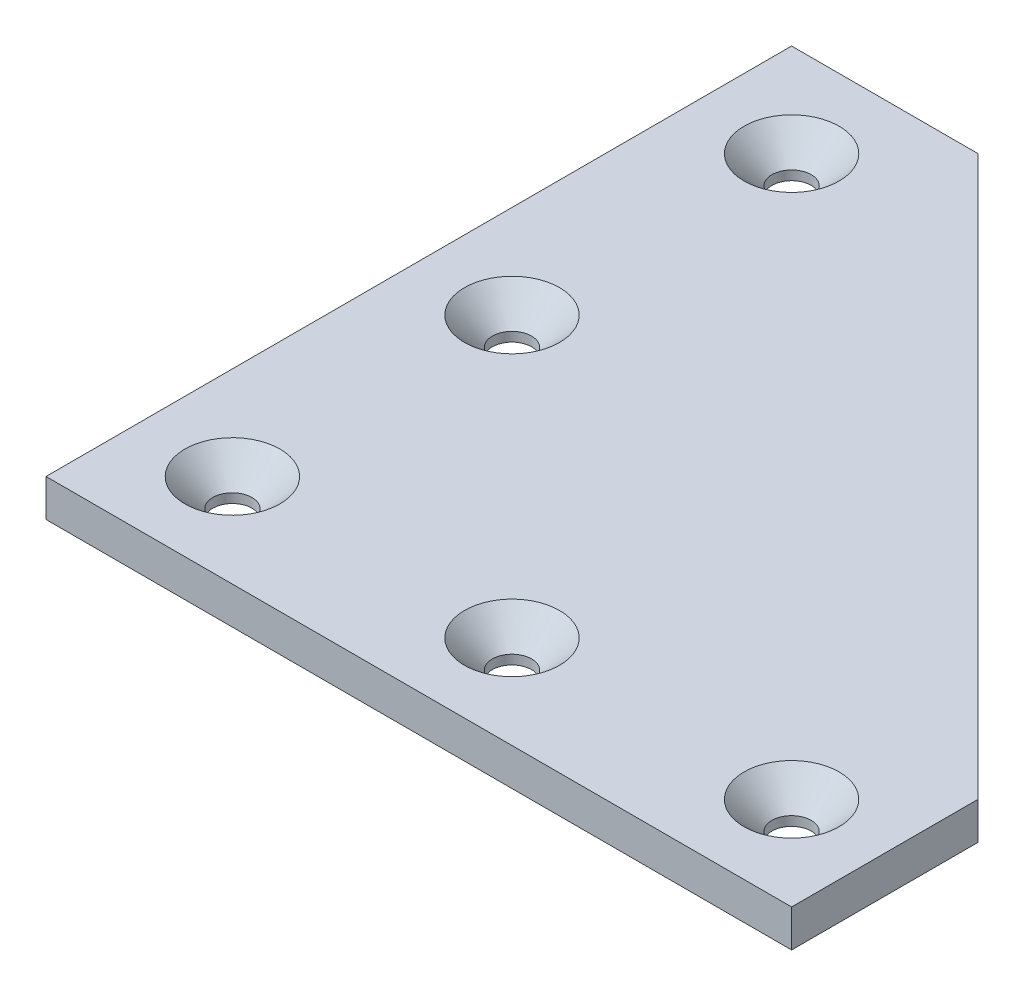
from build123d import *

# Parameters (mm, degrees)
BOSS_EXTRUDE1_DEPTH = 4
SKETCH3_R           = 2.1
CUT_EXTRUDE1_DEPTH  = 4
CHAMFER1_SIZE       = 3


with BuildPart() as part:
    # Sketch1 → Boss-Extrude1 (new body)
    with BuildSketch(Plane(origin=(0, 0, 0), x_dir=(1, 0, 0), z_dir=(0, 1, 0))):
        Polygon((0, 0), (0, 80), (20, 80), (80, 20), (80, 0), align=None)
    extrude(amount=BOSS_EXTRUDE1_DEPTH)

    # Sketch3 → Cut-Extrude1 (cut)
    with BuildSketch(Plane(origin=(0, 4, 0), x_dir=(1, 0, 0), z_dir=(0, 1, 0))):
        with Locations((10, 10)):
            Circle(SKETCH3_R)
        with Locations((40, 10)):
            Circle(SKETCH3_R)
        with Locations((70, 10)):
            Circle(SKETCH3_R)
        with Locations((10, 40)):
            Circle(SKETCH3_R)
        with Locations((10, 70)):
            Circle(SKETCH3_R)
    extrude(amount=-CUT_EXTRUDE1_DEPTH, mode=Mode.SUBTRACT)

    # Chamfer1
    chamfer1_edges = [part.edges().sort_by_distance(p)[0] for p in [
        (67.9, 4, -10),
        (37.9, 4, -10),
        (7.9, 4, -10),
        (7.9, 4, -40),
        (7.9, 4, -70),
    ]]
    chamfer(chamfer1_edges, length=CHAMFER1_SIZE)


solid = part.part
